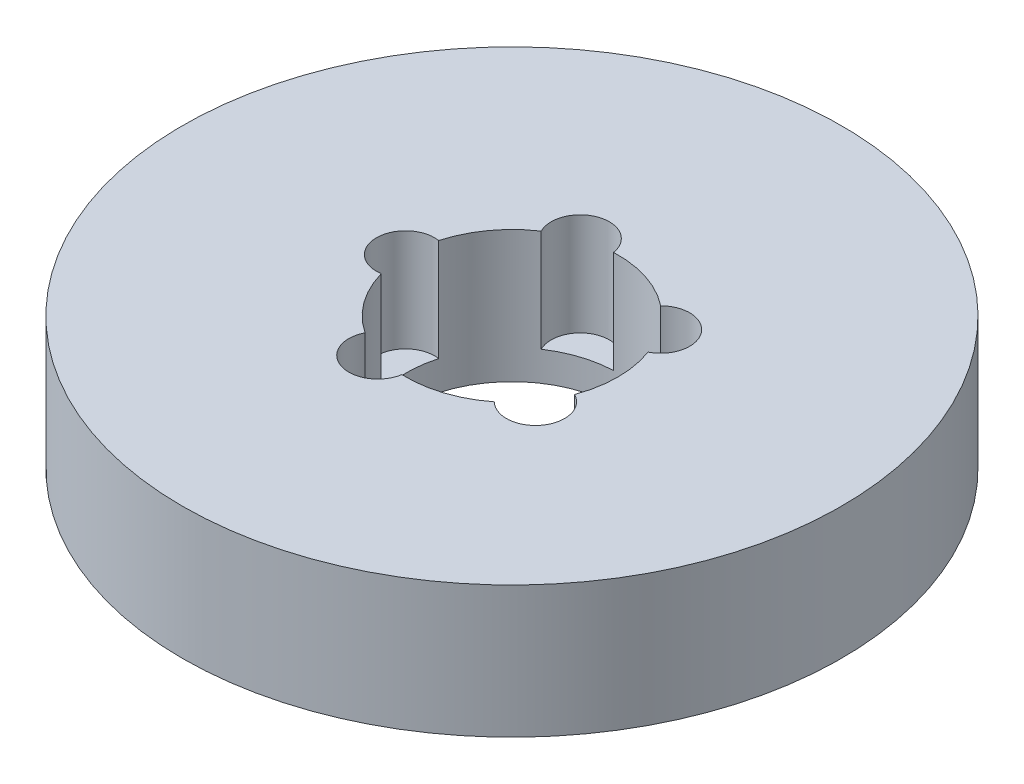
from build123d import *

# Parameters (mm, degrees)
SKETCH1_R           = 70
BOSS_EXTRUDE1_DEPTH = 28
SKETCH2_R           = 22.5
CUT_EXTRUDE1_DEPTH  = 103.878569197
SKETCH3_R           = 6.173893298
CUT_EXTRUDE2_DEPTH  = 21.727717711
CIRPATTERN1_COUNT   = 5


with BuildPart() as part:
    # Sketch1 → Boss-Extrude1 (new body)
    with BuildSketch(Plane(origin=(0, 0, 0), x_dir=(1, 0, 0), z_dir=(0, 1, 0))):
        Circle(SKETCH1_R)
    extrude(amount=BOSS_EXTRUDE1_DEPTH)

    # Sketch2 → Cut-Extrude1 (cut, through all)
    with BuildSketch(Plane(origin=(0, 0, 0), x_dir=(1, 0, 0), z_dir=(0, 1, 0))):
        Circle(SKETCH2_R)
    extrude(amount=CUT_EXTRUDE1_DEPTH, mode=Mode.SUBTRACT)

    # Sketch3 → Cut-Extrude2 (cut)
    with BuildSketch(Plane(origin=(0, 28, 0), x_dir=(1, 0, 0), z_dir=(0, 1, 0))):
        with Locations((-22.606030373, 0)):
            Circle(SKETCH3_R)
    cut_extrude2 = extrude(amount=-CUT_EXTRUDE2_DEPTH, mode=Mode.SUBTRACT)

    # CirPattern1: Cut-Extrude2 ×5 about axis
    cirpattern1_axis = Axis((0, 0, 0), (0, 1, 0))
    for i in range(1, CIRPATTERN1_COUNT):
        add(cut_extrude2.rotate(cirpattern1_axis, i * 360 / CIRPATTERN1_COUNT), mode=Mode.SUBTRACT)


solid = part.part
